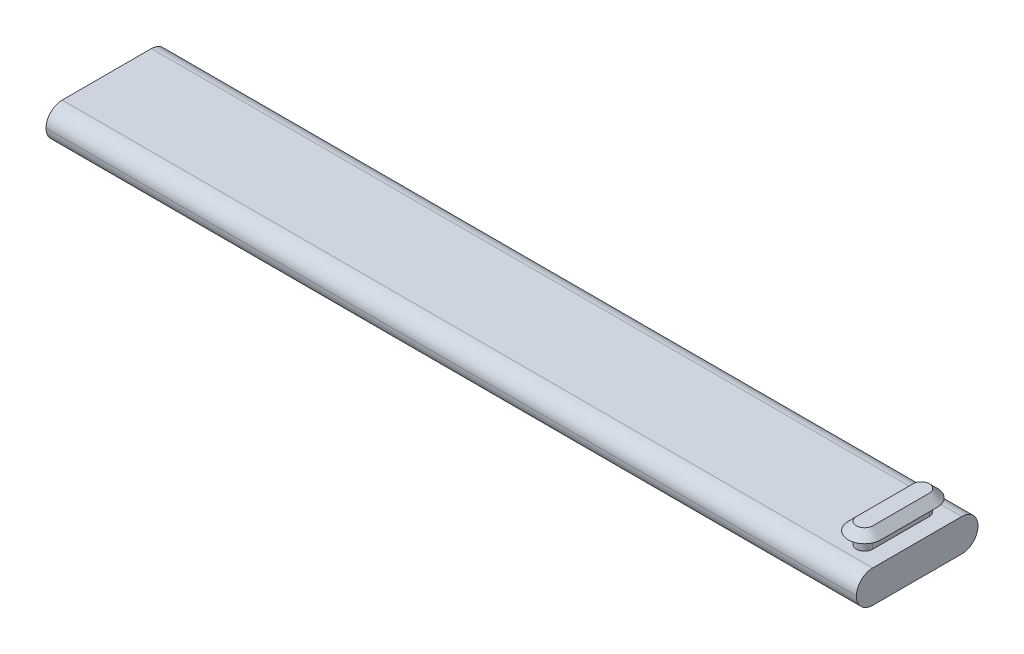
from build123d import *

# Parameters (mm, degrees)
SKETCH2_W           = 100
SKETCH2_H           = 15
BOSS_EXTRUDE1_DEPTH = 4
FILLET4_R           = 2
BOSS_EXTRUDE4_DEPTH = 1.5


with BuildPart() as part:
    # Sketch2 → Boss-Extrude1 (new body)
    with BuildSketch(Plane(origin=(0, 0, 0), x_dir=(1, 0, 0), z_dir=(0, 1, 0))):
        with Locations((7.846153846, -6.346153846)):
            Rectangle(SKETCH2_W, SKETCH2_H)
    extrude(amount=BOSS_EXTRUDE1_DEPTH)

    # Fillet4
    fillet4_edges = [part.edges().sort_by_distance(p)[0] for p in [
        (7.846153846, 4, -1.153846154),
        (7.846153846, 0, -1.153846154),
        (7.846153846, 4, 13.846153846),
        (7.846153846, 0, 13.846153846),
    ]]
    fillet(fillet4_edges, radius=FILLET4_R - 0.0001)  # a hair under: the kernel refuses the full size

    # Sketch10 → Boss-Extrude4 (add)
    with BuildSketch(Plane(origin=(0, 4, 0), x_dir=(1, 0, 0), z_dir=(0, 1, 0))):
        with BuildLine():
            Line((53.846153846, -9.846153846), (53.846153846, -2.846153846))
            ThreePointArc((53.846153846, -2.846153846), (54.846153846, -1.846153846), (55.846153846, -2.846153846))
            Line((55.846153846, -2.846153846), (55.846153846, -9.846153846))
            ThreePointArc((55.846153846, -9.846153846), (54.846153846, -10.846153846), (53.846153846, -9.846153846))
        make_face()
    extrude(amount=BOSS_EXTRUDE4_DEPTH)

    # Loft6: read off the stored shape, not the designer's step
    # Loft6: loft between two sections, ruled curve by curve
    loft6_from = [
        Edge.make_bspline([(52.846153846, 5.5, 6.346153846), (52.846153846, 5.5, 6.893229755), (52.846153846, 5.5, 7.987381572), (52.846153846, 5.5, 9.172470024), (52.846153846, 5.5, 10.062777988), (52.916794739, 5.5, 10.520533365), (53.297264612, 5.5, 11.19493708), (53.970100399, 5.5, 11.713677023), (54.846153846, 5.5, 11.912823977), (55.722207294, 5.5, 11.713677023), (56.395043081, 5.5, 11.19493708), (56.775512954, 5.5, 10.520533365), (56.846153846, 5.5, 10.062777988), (56.846153846, 5.5, 9.172470024), (56.846153846, 5.5, 7.987381572), (56.846153846, 5.5, 6.346153846), (56.846153846, 5.5, 4.70492612), (56.846153846, 5.5, 3.519837669), (56.846153846, 5.5, 2.629529705), (56.775512954, 5.5, 2.171774328), (56.395043081, 5.5, 1.497370612), (55.722207294, 5.5, 0.97863067), (54.846153846, 5.5, 0.779483716), (53.970100399, 5.5, 0.97863067), (53.297264612, 5.5, 1.497370612), (52.916794739, 5.5, 2.171774328), (52.846153846, 5.5, 2.629529705), (52.846153846, 5.5, 3.519837669), (52.846153846, 5.5, 4.70492612), (52.846153846, 5.5, 5.799077937), (52.846153846, 5.5, 6.346153846)], [0.347848884, 0.347848884, 0.347848884, 0.347848884, 0.423924442, 0.5, 0.5, 0.524462221, 0.548924442, 0.573386663, 0.597848884, 0.622311105, 0.646773326, 0.671235547, 0.695697768, 0.695697768, 0.771773326, 0.847848884, 0.923924442, 1, 1, 1.024462221, 1.048924442, 1.073386663, 1.097848884, 1.122311105, 1.146773326, 1.171235547, 1.195697768, 1.195697768, 1.271773326, 1.347848884, 1.347848884, 1.347848884, 1.347848884], 3),
    ]
    loft6_to = [
        Edge.make_bspline([(53.846153846, 6.5, 6.346153846), (53.846153846, 6.5, 6.970863619), (53.846153846, 6.5, 8.220283163), (53.846153846, 6.5, 9.3318023), (53.846153846, 6.5, 10.011544432), (53.92463889, 6.5, 10.301418233), (54.169662015, 6.5, 10.614768288), (54.490600847, 6.5, 10.803946654), (54.846153846, 6.5, 10.867265337), (55.201706845, 6.5, 10.803946654), (55.522645677, 6.5, 10.614768288), (55.767668802, 6.5, 10.301418233), (55.846153846, 6.5, 10.011544432), (55.846153846, 6.5, 9.3318023), (55.846153846, 6.5, 8.220283163), (55.846153846, 6.5, 6.346153846), (55.846153846, 6.5, 4.472024529), (55.846153846, 6.5, 3.360505393), (55.846153846, 6.5, 2.68076326), (55.767668802, 6.5, 2.390889459), (55.522645677, 6.5, 2.077539404), (55.201706845, 6.5, 1.888361038), (54.846153846, 6.5, 1.825042355), (54.490600847, 6.5, 1.888361038), (54.169662015, 6.5, 2.077539404), (53.92463889, 6.5, 2.390889459), (53.846153846, 6.5, 2.68076326), (53.846153846, 6.5, 3.360505393), (53.846153846, 6.5, 4.472024529), (53.846153846, 6.5, 5.721444074), (53.846153846, 6.5, 6.346153846)], [0.347848884, 0.347848884, 0.347848884, 0.347848884, 0.423924442, 0.5, 0.5, 0.524462221, 0.548924442, 0.573386663, 0.597848884, 0.622311105, 0.646773326, 0.671235547, 0.695697768, 0.695697768, 0.771773326, 0.847848884, 0.923924442, 1, 1, 1.024462221, 1.048924442, 1.073386663, 1.097848884, 1.122311105, 1.146773326, 1.171235547, 1.195697768, 1.195697768, 1.271773326, 1.347848884, 1.347848884, 1.347848884, 1.347848884], 3),
    ]
    loft6 = Solid(Shell([*[Face.make_surface_from_curves(loft6_from[k], loft6_to[k]) for k in range(1)], Face(Wire(loft6_from)), Face(Wire(loft6_to))]))
    add(loft6)


solid = part.part
